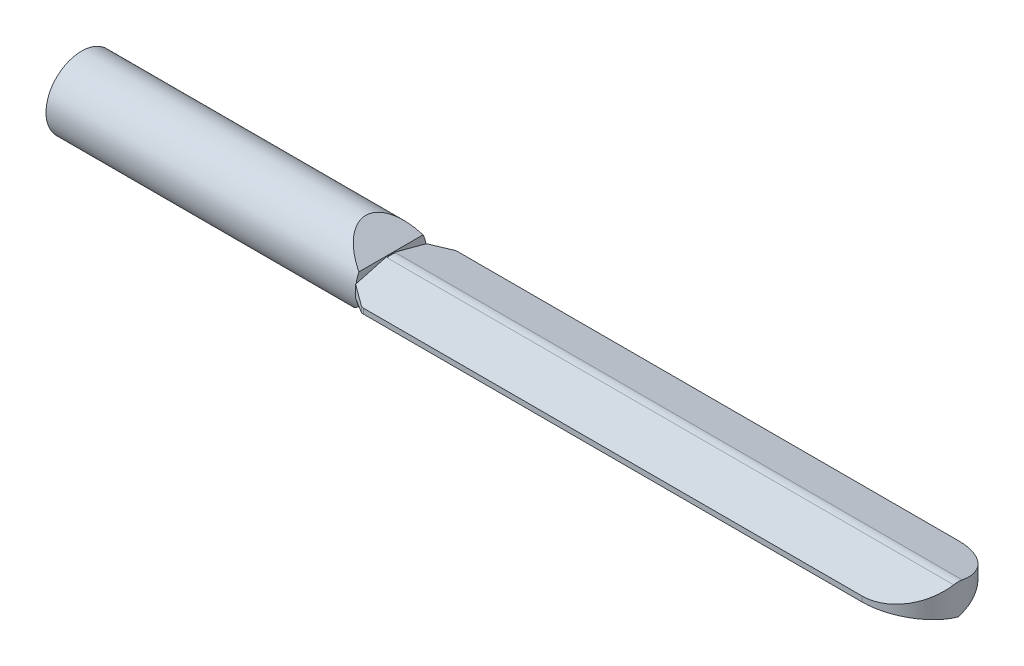
from build123d import *

# Parameters (mm, degrees)
BOSS_EXTRUDE2_DEPTH      = 5.6
CHAMFER2_SIZE            = 2.328478482
CHAMFER2_SIZE_2          = 8.69
CHAMFER3_SIZE            = 8.69
CHAMFER3_SIZE_2          = 2.328478482
CHAMFER4_SIZE            = 8.69
CHAMFER4_SIZE_2          = 2.328478482
CHAMFER5_SIZE            = 8.69
CHAMFER5_SIZE_2          = 2.328478482
FILLET1_R                = 1
SKETCH8_R                = 6.42
BOSS_EXTRUDE3_DEPTH      = 58
FILLET2_R                = 3
CUT_EXTRUDE12_DEPTH      = 16
CUT_EXTRUDE13_DEPTH      = 119.774223563
CUT_EXTRUDE13_DEPTH_BACK = 119.774223563
SKETCH19_W               = 4.551969905
SKETCH19_H               = 31.016999287


with BuildPart() as part:
    # Sketch3 → Boss-Extrude2 (new body)
    with BuildSketch(Plane(origin=(0, 0, 0), x_dir=(1, 0, 0), z_dir=(0, 1, 0))):
        with BuildLine():
            Line((-55.958218902, 0), (34.866239796, 0))
            ThreePointArc((34.866239796, 0), (43.555159042, -8.688919246), (34.866239796, -17.377838493))
            Line((34.866239796, -17.377838493), (-55.633760204, -17.377838493))
            Line((-55.633760204, -17.377838493), (-59.133760204, -14.977838493))
            Line((-59.133760204, -14.977838493), (-59.132241437, -8.577838493))
            Line((-59.132241437, -8.577838493), (-59.132241437, -2.173298587))
            Line((-59.132241437, -2.173298587), (-55.958218902, 0))
        make_face()
    extrude(amount=BOSS_EXTRUDE2_DEPTH)

    # Chamfer2
    # the kernel refuses this chamfer: 8.69, 2.328478482 mm, written as the material it takes off along each edge
    with BuildSketch(Plane(origin=(57.431750241, 5.6, 17.377838493), x_dir=(0, -0.9905000388259545, 0.13751244702128881), z_dir=(-1, 0, 0))) as chamfer2_piece_1:
        Polygon((CHAMFER2_SIZE * 0.990500038922, -CHAMFER2_SIZE * 0.137512447035), (-CHAMFER2_SIZE_2 * 0.137512447021, -CHAMFER2_SIZE_2 * 0.990500038826), (0, 0), align=None)
    extrude(amount=135.63102089, mode=Mode.SUBTRACT)

    # Chamfer3
    # the kernel refuses this chamfer: 8.69, 2.328478482 mm, written as the material it takes off along each edge
    with BuildSketch(Plane(origin=(57.431750241, 0, 17.377838493), x_dir=(0, -0.009967146577156423, -0.9999503267608394), z_dir=(-1, 0, 0))) as chamfer3_piece_1:
        Polygon((CHAMFER3_SIZE * 0.999950326761, -CHAMFER3_SIZE * 0.00996714657716), (-CHAMFER3_SIZE_2 * 0.00996714657813, -CHAMFER3_SIZE_2 * 0.999950326858), (0, 0), align=None)
    extrude(amount=135.63102089, mode=Mode.SUBTRACT)

    # Chamfer4
    # the kernel refuses this chamfer: 8.69, 2.328478482 mm, written as the material it takes off along each edge
    with BuildSketch(Plane(origin=(-78.523729347, 5.6, 0), x_dir=(0, 0.00996714657715643, 0.9999503267608394), z_dir=(1, 0, 0))) as chamfer4_piece_1:
        Polygon((CHAMFER4_SIZE * 0.999950326761, CHAMFER4_SIZE * 0.00996714657716), (-CHAMFER4_SIZE_2 * 0.00996714657813, CHAMFER4_SIZE_2 * 0.999950326858), (0, 0), align=None)
    extrude(amount=135.955479588, mode=Mode.SUBTRACT)

    # Chamfer5
    # the kernel refuses this chamfer: 8.69, 2.328478482 mm, written as the material it takes off along each edge
    with BuildSketch(Plane(origin=(-78.523729347, 0, 0), x_dir=(0, -0.009967146577156423, 0.9999503267608394), z_dir=(1, 0, 0))) as chamfer5_piece_1:
        Polygon((CHAMFER5_SIZE * 0.999950326761, -CHAMFER5_SIZE * 0.00996714657716), (-CHAMFER5_SIZE_2 * 0.00996714657813, -CHAMFER5_SIZE_2 * 0.999950326858), (0, 0), align=None)
    extrude(amount=135.955479588, mode=Mode.SUBTRACT)

    # Fillet1
    fillet1_edges = [part.edges().sort_by_distance(p)[0] for p in [
        (-55.633760204, 2.8, 17.377838493),
    ]]
    fillet(fillet1_edges, radius=FILLET1_R)

    # Sketch8 → Boss-Extrude3 (add)
    with BuildSketch(Plane(origin=(-59.130202523, 0, -0.014032034), x_dir=(-0.00023730738394525297, 0, 0.9999999718426024), z_dir=(-0.9999999718426024, 0, -0.00023730738394525297))):
        with Locations(Location((8.591870769, 2.8, 0), (0, 0, 183.840787638))):
            Circle(SKETCH8_R)
    extrude(amount=BOSS_EXTRUDE3_DEPTH)

    # Fillet2
    fillet2_edges = [part.edges().sort_by_distance(p)[0] for p in [
        (-7.788554378, 5.599710413, 8.688919246),
    ]]
    fillet(fillet2_edges, radius=FILLET2_R)

    # Sketch16 → Cut-Extrude12 (cut)
    with BuildSketch(Plane.XY):
        Polygon((-58.943650552, 9.22), (-63.693726721, 9.22), (-58.943650552, 5.391659351), align=None)
        Polygon((-58.943650552, -3.62), (-63.693726721, -3.62), (-58.943650552, 0.208340649), align=None)
    extrude(amount=CUT_EXTRUDE12_DEPTH, mode=Mode.SUBTRACT)

    # Sketch19 → Cut-Extrude13 (cut, two sides: drawn at the far end of the back side and taken through both)
    with BuildSketch(Plane(origin=(0, 0, 0), x_dir=(1, 0, 0), z_dir=(0, 1, 0)).offset(-CUT_EXTRUDE13_DEPTH_BACK)):
        with Locations((-117.406701244, -5.968129835)):
            Rectangle(SKETCH19_W, SKETCH19_H)
    extrude(amount=CUT_EXTRUDE13_DEPTH + CUT_EXTRUDE13_DEPTH_BACK, mode=Mode.SUBTRACT)


solid = part.part
